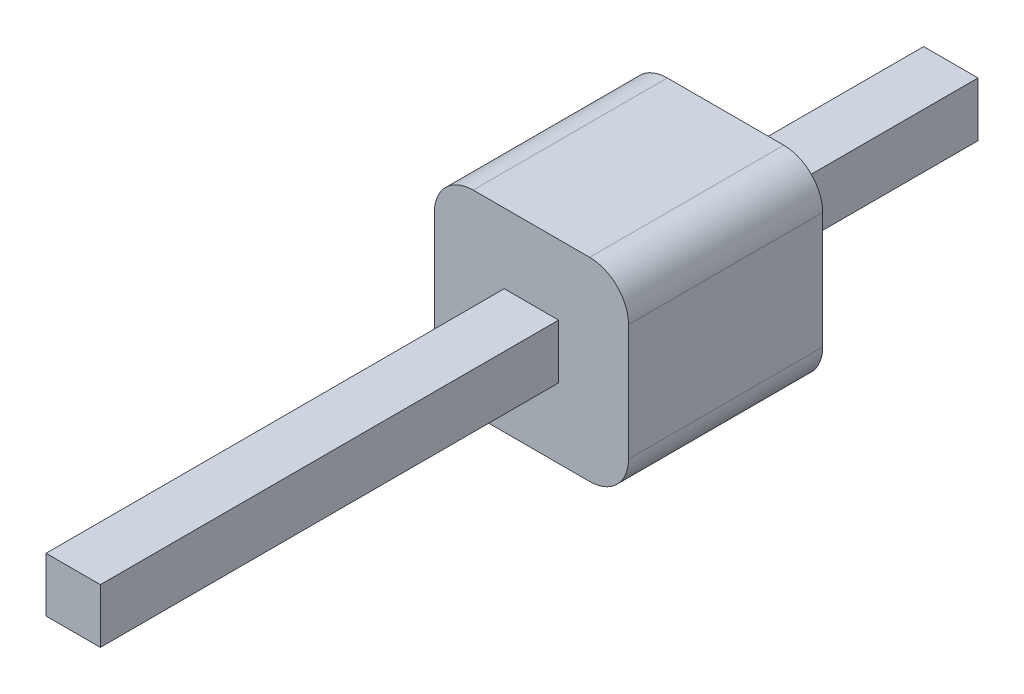
from build123d import *

# Parameters (mm, degrees)
CROQUIS1_W              = 0.7
CROQUIS1_H              = 0.7
SALIENTE_EXTRUIR1_DEPTH = 11.3
CROQUIS2_W              = 2.5
CROQUIS2_H              = 2.5
SALIENTE_EXTRUIR2_DEPTH = 2.5
REDONDEO1_R             = 0.5


with BuildPart() as part:
    # Croquis1 → Saliente-Extruir1 (new body)
    with BuildSketch(Plane.XY):
        Rectangle(CROQUIS1_W, CROQUIS1_H)
    extrude(amount=SALIENTE_EXTRUIR1_DEPTH)

    # Croquis2 → Saliente-Extruir2 (add)
    with BuildSketch(Plane(origin=(0, 0, 2.9), x_dir=(-1, 0, 0), z_dir=(0, 0, -1))):
        Rectangle(CROQUIS2_W, CROQUIS2_H)
    extrude(amount=-SALIENTE_EXTRUIR2_DEPTH)

    # Redondeo1
    redondeo1_edges = [part.edges().sort_by_distance(p)[0] for p in [
        (-1.25, -1.25, 4.15),
        (-1.25, 1.25, 4.15),
        (1.25, 1.25, 4.15),
        (1.25, -1.25, 4.15),
    ]]
    fillet(redondeo1_edges, radius=REDONDEO1_R)


solid = part.part
